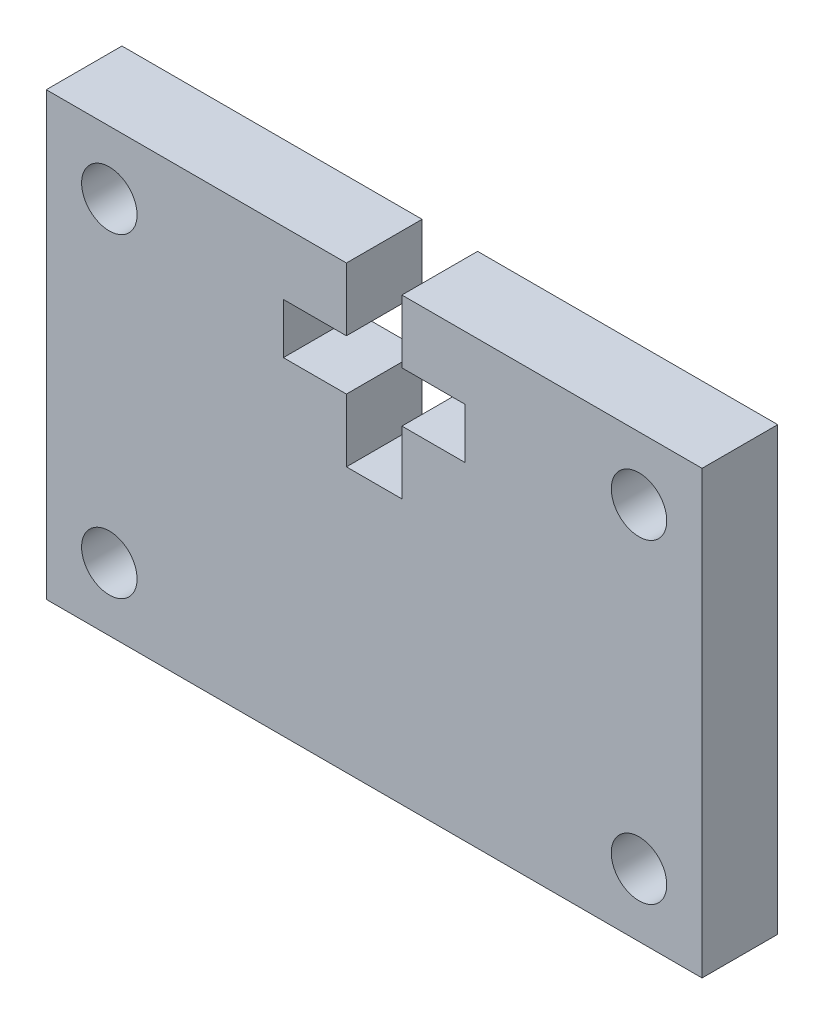
from build123d import *

# Parameters (mm, degrees)
SKETCH1_R           = 1.1
BOSS_EXTRUDE1_DEPTH = 3


with BuildPart() as part:
    # Sketch1 → Boss-Extrude1 (new body)
    with BuildSketch(Plane.XY):
        Polygon((-13, -8.75), (13, -8.75), (13, 8.75), (1.1, 8.75), (1.1, 6.25), (3.6, 6.25), (3.6, 4.25), (1.1, 4.25), (1.1, 1.75), (-1.1, 1.75), (-1.1, 4.25), (-3.6, 4.25), (-3.6, 6.25), (-1.1, 6.25), (-1.1, 8.75), (-13, 8.75), align=None)
        with Locations((-10.5, 6.25)):
            Circle(SKETCH1_R, mode=Mode.SUBTRACT)
        with Locations((-10.5, -6.25)):
            Circle(SKETCH1_R, mode=Mode.SUBTRACT)
        with Locations((10.5, -6.25)):
            Circle(SKETCH1_R, mode=Mode.SUBTRACT)
        with Locations((10.5, 6.25)):
            Circle(SKETCH1_R, mode=Mode.SUBTRACT)
    extrude(amount=BOSS_EXTRUDE1_DEPTH)


solid = part.part
